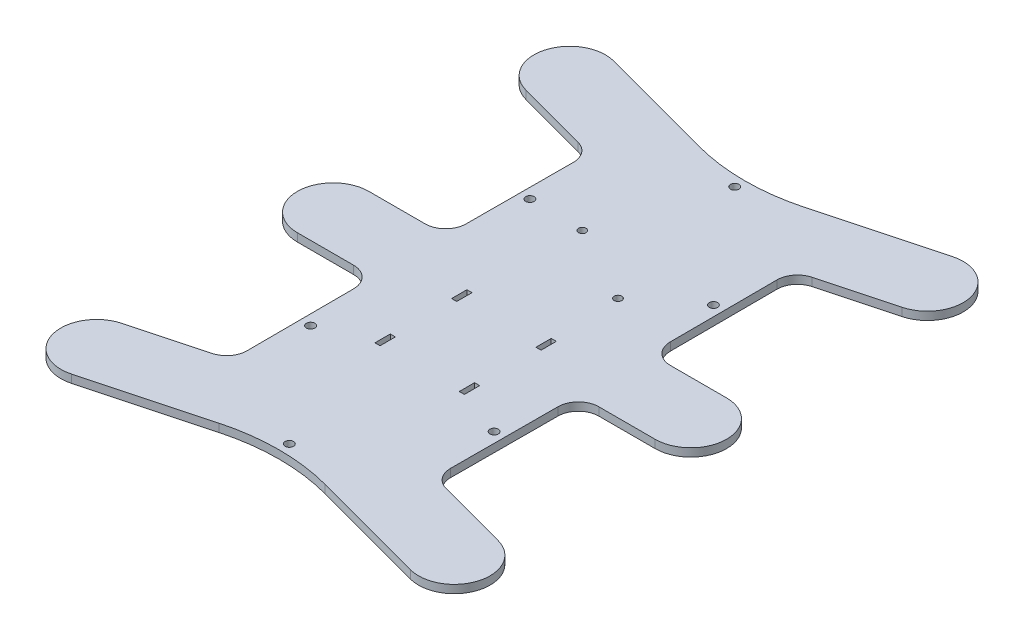
from build123d import *

# Parameters (mm, degrees)
BOSS_EXTRUDE1_DEPTH = 3.175
FILLET1_R           = 80
FILLET2_R           = 8
SKETCH2_R           = 1.65
CUT_EXTRUDE1_DEPTH  = 10
CUT_EXTRUDE2_DEPTH  = 10
SKETCH4_W           = 2
SKETCH4_H           = 6
CUT_EXTRUDE3_DEPTH  = 10


with BuildPart() as part:
    # Sketch1 → Boss-Extrude1 (new body)
    with BuildSketch(Plane(origin=(0, 0, 0), x_dir=(1, 0, 0), z_dir=(0, 1, 0))):
        with BuildLine():
            Line((-70, 14), (-40, 14))
            Line((-40, 14), (-39.816062711, 70))
            Line((-39.816062711, 70), (-73.623466631, 79.058666579))
            ThreePointArc((-73.623466631, 79.058666579), (-83.522961568, 96.205094778), (-66.376533369, 106.104589715))
            Line((-66.376533369, 106.104589715), (0, 88.319051202))
            Line((0, 88.319051202), (66.376533369, 106.104589715))
            ThreePointArc((66.376533369, 106.104589715), (83.522961568, 96.205094778), (73.623466631, 79.058666579))
            Line((73.623466631, 79.058666579), (39.816062711, 70))
            Line((39.816062711, 70), (40, 14))
            Line((40, 14), (70, 14))
            ThreePointArc((70, 14), (84, 0), (70, -14))
            Line((70, -14), (40, -14))
            Line((40, -14), (39.816062711, -70))
            Line((39.816062711, -70), (73.623466631, -79.058666579))
            ThreePointArc((73.623466631, -79.058666579), (83.522961568, -96.205094778), (66.376533369, -106.104589715))
            Line((66.376533369, -106.104589715), (0, -88.319051202))
            Line((0, -88.319051202), (-66.376533369, -106.104589715))
            ThreePointArc((-66.376533369, -106.104589715), (-83.522961568, -96.205094778), (-73.623466631, -79.058666579))
            Line((-73.623466631, -79.058666579), (-39.816062711, -70))
            Line((-39.816062711, -70), (-40, -14))
            Line((-40, -14), (-70, -14))
            ThreePointArc((-70, -14), (-84, 0), (-70, 14))
        make_face()
    extrude(amount=BOSS_EXTRUDE1_DEPTH)

    # Fillet1
    fillet1_edges = [part.edges().sort_by_distance(p)[0] for p in [
        (0, 1.5875, -88.319051202),
        (0, 1.5875, 88.319051202),
    ]]
    fillet(fillet1_edges, radius=FILLET1_R)

    # Fillet2
    fillet2_edges = [part.edges().sort_by_distance(p)[0] for p in [
        (39.816062711, 1.5875, 70),
        (40, 1.5875, 14),
        (40, 1.5875, -14),
        (39.816062711, 1.5875, -70),
        (-39.816062711, 1.5875, -70),
        (-40, 1.5875, -14),
        (-40, 1.5875, 14),
        (-39.816062711, 1.5875, 70),
    ]]
    fillet(fillet2_edges, radius=FILLET2_R)

    # Sketch2 → Cut-Extrude1 (cut)
    with BuildSketch(Plane(origin=(0, 3.175, 0), x_dir=(1, 0, 0), z_dir=(0, 1, 0))):
        with Locations((0, 87.141145635)):
            Circle(SKETCH2_R)
        with Locations((-35.905030257, 42.907120147)):
            Circle(SKETCH2_R)
        with Locations((35.905030257, 42.907120147)):
            Circle(SKETCH2_R)
        with Locations((35.905030257, -42.907120147)):
            Circle(SKETCH2_R)
        with Locations((0, -87.141145635)):
            Circle(SKETCH2_R)
        with Locations((-35.905030257, -42.907120147)):
            Circle(SKETCH2_R)
    extrude(amount=-CUT_EXTRUDE1_DEPTH, mode=Mode.SUBTRACT)

    # Sketch3 → Cut-Extrude2 (cut)
    with BuildSketch(Plane(origin=(0, 3.175, 0), x_dir=(1, 0, 0), z_dir=(0, 1, 0))):
        with BuildLine():
            ThreePointArc((13.5, 26.5), (15, 25), (16.5, 26.5))
            ThreePointArc((16.5, 26.5), (15, 28), (13.5, 26.5))
        make_face()
        with BuildLine():
            ThreePointArc((-16.5, 42.5), (-15, 41), (-13.5, 42.5))
            ThreePointArc((-13.5, 42.5), (-15, 44), (-16.5, 42.5))
        make_face()
    extrude(amount=-CUT_EXTRUDE2_DEPTH, mode=Mode.SUBTRACT)

    # Sketch4 → Cut-Extrude3 (cut)
    with BuildSketch(Plane(origin=(0, 3.175, 0), x_dir=(1, 0, 0), z_dir=(0, 1, 0))):
        with Locations((-16.5, -33.141145635)):
            Rectangle(SKETCH4_W, SKETCH4_H)
        with Locations((16.5, -3.141145635)):
            Rectangle(SKETCH4_W, SKETCH4_H)
        with Locations((16.5, -33.141145635)):
            Rectangle(SKETCH4_W, SKETCH4_H)
        with Locations((-16.5, -3.141145635)):
            Rectangle(SKETCH4_W, SKETCH4_H)
    extrude(amount=-CUT_EXTRUDE3_DEPTH, mode=Mode.SUBTRACT)


solid = part.part
